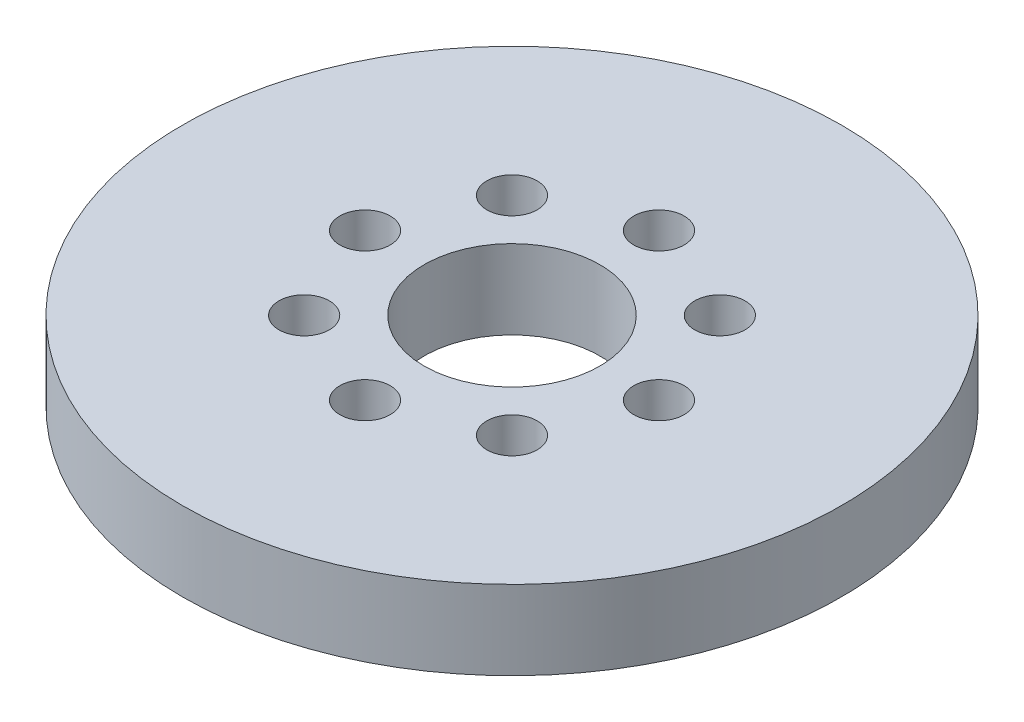
from build123d import *

# Parameters (mm, degrees)
SKETCH1_R           = 75
BOSS_EXTRUDE1_DEPTH = 18
SKETCH2_R           = 20
CUT_EXTRUDE1_DEPTH  = 108.582526462
SKETCH3_R           = 5.73224068
CUT_EXTRUDE2_DEPTH  = 11.481584317
CIRPATTERN1_COUNT   = 8


with BuildPart() as part:
    # Sketch1 → Boss-Extrude1 (new body)
    with BuildSketch(Plane(origin=(0, 0, 0), x_dir=(1, 0, 0), z_dir=(0, 1, 0))):
        Circle(SKETCH1_R)
    extrude(amount=BOSS_EXTRUDE1_DEPTH)

    # Sketch2 → Cut-Extrude1 (cut, through all)
    with BuildSketch(Plane(origin=(0, 0, 0), x_dir=(1, 0, 0), z_dir=(0, 1, 0))):
        Circle(SKETCH2_R)
    extrude(amount=CUT_EXTRUDE1_DEPTH, mode=Mode.SUBTRACT)

    # Sketch3 → Cut-Extrude2 (cut)
    with BuildSketch(Plane(origin=(0, 18, 0), x_dir=(1, 0, 0), z_dir=(0, 1, 0))):
        with Locations((-33.447507615, 0)):
            Circle(SKETCH3_R)
    cut_extrude2 = extrude(amount=-CUT_EXTRUDE2_DEPTH, mode=Mode.SUBTRACT)

    # CirPattern1: Cut-Extrude2 ×8 about axis
    cirpattern1_axis = Axis((0, 0, 0), (0, 1, 0))
    for i in range(1, CIRPATTERN1_COUNT):
        add(cut_extrude2.rotate(cirpattern1_axis, i * 360 / CIRPATTERN1_COUNT), mode=Mode.SUBTRACT)


solid = part.part
